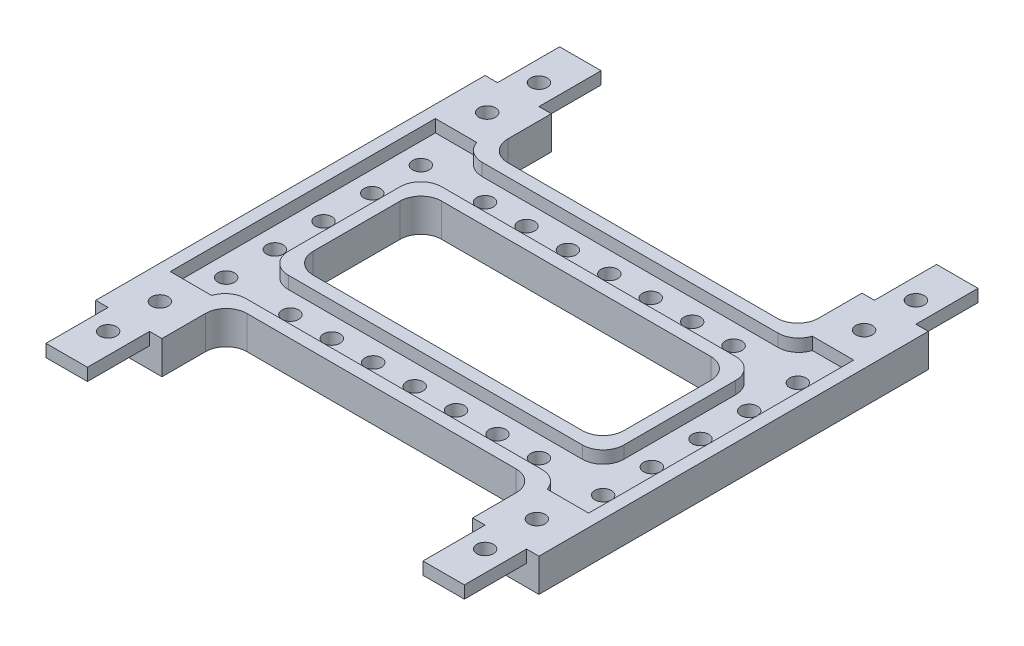
from build123d import *

# Parameters (mm, degrees)
BOSS_EXTRUDE2_DEPTH = 5
SKETCH3_W           = 3
SKETCH3_H           = 94
SKETCH3_W_2         = 75
SKETCH3_H_2         = 31
BOSS_EXTRUDE4_DEPTH = 3
BOSS_EXTRUDE5_DEPTH = 3
SKETCH5_R           = 2
CUT_EXTRUDE1_DEPTH  = 5
SKETCH6_R           = 2
CUT_EXTRUDE2_DEPTH  = 3
SKETCH7_R           = 2
CUT_EXTRUDE3_DEPTH  = 8
FILLET1_R           = 5
FILLET2_R           = 5


with BuildPart() as part:
    # Sketch1 → Boss-Extrude2 (new body)
    with BuildSketch(Plane(origin=(0, 0, 0), x_dir=(1, 0, 0), z_dir=(0, 1, 0))):
        Polygon((-51.065846009, -44.178571429), (-59.065846009, -44.178571429), (-59.065846009, 49.821428571), (-51.065846009, 49.821428571), (-43.065846009, 49.821428571), (-43.065846009, 39.321428571), (-43.065846009, 34.321428571), (-38.065846009, 34.321428571), (26.934153991, 34.321428571), (31.934153991, 34.321428571), (31.934153991, 39.321428571), (31.934153991, 49.821428571), (39.934153991, 49.821428571), (47.934153991, 49.821428571), (47.934153991, -44.178571429), (39.934153991, -44.178571429), (31.934153991, -44.178571429), (31.934153991, -33.678571429), (31.934153991, -28.678571429), (26.934153991, -28.678571429), (-38.065846009, -28.678571429), (-43.065846009, -28.678571429), (-43.065846009, -33.678571429), (-43.065846009, -44.178571429), align=None)
        Polygon((-43.065846009, 13.321428571), (-43.065846009, -7.678571429), (-43.065846009, -12.678571429), (-38.065846009, -12.678571429), (26.934153991, -12.678571429), (31.934153991, -12.678571429), (31.934153991, -7.678571429), (31.934153991, 13.321428571), (31.934153991, 18.321428571), (26.934153991, 18.321428571), (-38.065846009, 18.321428571), (-43.065846009, 18.321428571), align=None, mode=Mode.SUBTRACT)
    extrude(amount=BOSS_EXTRUDE2_DEPTH)

    # Sketch3 → Boss-Extrude4 (add)
    # profile 1 of 5: a face of its own
    with BuildSketch(Plane(origin=(0, 5, 0), x_dir=(1, 0, 0), z_dir=(0, 1, 0))):
        with Locations((-57.565846009, 2.821428571)):
            Rectangle(SKETCH3_W, SKETCH3_H)
    # profile 2 of 5: a face of its own
    with BuildSketch(Plane(origin=(0, 5, 0), x_dir=(1, 0, 0), z_dir=(0, 1, 0))):
        with Locations((46.434153991, 2.821428571)):
            Rectangle(SKETCH3_W, SKETCH3_H)
    # profile 3 of 5: a face of its own
    with BuildSketch(Plane(origin=(0, 5, 0), x_dir=(1, 0, 0), z_dir=(0, 1, 0))):
        Polygon((-43.065846009, 49.821428571), (-46.065846009, 49.821428571), (-46.065846009, 34.321428571), (-46.065846009, 31.321428571), (31.934153991, 31.321428571), (34.934153991, 31.321428571), (34.934153991, 49.821428571), (31.934153991, 49.821428571), (31.934153991, 34.321428571), (-43.065846009, 34.321428571), align=None)
    # profile 4 of 5: a face of its own
    with BuildSketch(Plane(origin=(0, 5, 0), x_dir=(1, 0, 0), z_dir=(0, 1, 0))):
        Polygon((34.934153991, 21.321428571), (34.934153991, -12.678571429), (34.934153991, -15.678571429), (-46.065846009, -15.678571429), (-46.065846009, 21.321428571), (31.934153991, 21.321428571), align=None)
        with Locations((-5.565846009, 2.821428571)):
            Rectangle(SKETCH3_W_2, SKETCH3_H_2, mode=Mode.SUBTRACT)
    # profile 5 of 5: a face of its own
    with BuildSketch(Plane(origin=(0, 5, 0), x_dir=(1, 0, 0), z_dir=(0, 1, 0))):
        Polygon((-46.065846009, -44.178571429), (-43.065846009, -44.178571429), (-43.065846009, -28.678571429), (31.934153991, -28.678571429), (31.934153991, -44.178571429), (34.934153991, -44.178571429), (34.934153991, -28.678571429), (34.934153991, -25.678571429), (-46.065846009, -25.678571429), align=None)
    extrude(amount=BOSS_EXTRUDE4_DEPTH)

    # Sketch4 → Boss-Extrude5 (add)
    with BuildSketch(Plane(origin=(0, 5, 0), x_dir=(1, 0, 0), z_dir=(0, 1, 0))):
        Polygon((-46.065846009, -59.178571429), (-46.065846009, -29.178571429), (-56.065846009, -29.178571429), (-56.065846009, -59.178571429), (-51.065846009, -59.178571429), align=None)
        Polygon((39.934153991, -59.178571429), (44.934153991, -59.178571429), (44.934153991, -29.178571429), (34.934153991, -29.178571429), (34.934153991, -59.178571429), align=None)
        Polygon((-46.065846009, 34.821428571), (-46.065846009, 64.821428571), (-56.065846009, 64.821428571), (-56.065846009, 34.821428571), (-51.065846009, 34.821428571), align=None)
        Polygon((44.934153991, 34.821428571), (44.934153991, 64.821428571), (34.934153991, 64.821428571), (34.934153991, 34.821428571), (39.934153991, 34.821428571), align=None)
    extrude(amount=BOSS_EXTRUDE5_DEPTH)

    # Sketch5 → Cut-Extrude1 (cut)
    with BuildSketch(Plane(origin=(0, 5, 0), x_dir=(1, 0, 0), z_dir=(0, 1, 0))):
        with Locations(Location((-51.065846009, 26.321428571, 0), (0, 0, 270))):
            Circle(SKETCH5_R)
        with Locations(Location((39.934153991, 26.321428571, 0), (0, 0, 270))):
            Circle(SKETCH5_R)
        with Locations(Location((39.934153991, -20.678571429, 0), (0, 0, 270))):
            Circle(SKETCH5_R)
        with Locations(Location((-51.065846009, -20.678571429, 0), (0, 0, 270))):
            Circle(SKETCH5_R)
        with Locations(Location((-51.065846009, 2.821428571, 0), (0, 0, 270))):
            Circle(SKETCH5_R)
        with Locations(Location((39.934153991, 2.821428571, 0), (0, 0, 270))):
            Circle(SKETCH5_R)
        with Locations(Location((-51.065846009, 14.571428571, 0), (0, 0, 270))):
            Circle(SKETCH5_R)
        with Locations(Location((-51.065846009, -8.928571429, 0), (0, 0, 270))):
            Circle(SKETCH5_R)
        with Locations(Location((-5.565846009, 26.321428571, 0), (0, 0, 270))):
            Circle(SKETCH5_R)
        with Locations(Location((14.434153991, 26.321428571, 0), (0, 0, 270))):
            Circle(SKETCH5_R)
        with Locations(Location((24.434153991, 26.321428571, 0), (0, 0, 270))):
            Circle(SKETCH5_R)
        with Locations(Location((-25.565846009, 26.321428571, 0), (0, 0, 270))):
            Circle(SKETCH5_R)
        with Locations(Location((4.434153991, 26.321428571, 0), (0, 0, 270))):
            Circle(SKETCH5_R)
        with Locations(Location((-35.565846009, 26.321428571, 0), (0, 0, 270))):
            Circle(SKETCH5_R)
        with Locations(Location((-15.565846009, 26.321428571, 0), (0, 0, 270))):
            Circle(SKETCH5_R)
        with Locations(Location((-5.565846009, -20.678571429, 0), (0, 0, 270))):
            Circle(SKETCH5_R)
        with Locations(Location((14.434153991, -20.678571429, 0), (0, 0, 270))):
            Circle(SKETCH5_R)
        with Locations(Location((24.434153991, -20.678571429, 0), (0, 0, 270))):
            Circle(SKETCH5_R)
        with Locations(Location((-25.565846009, -20.678571429, 0), (0, 0, 270))):
            Circle(SKETCH5_R)
        with Locations(Location((4.434153991, -20.678571429, 0), (0, 0, 270))):
            Circle(SKETCH5_R)
        with Locations(Location((-35.565846009, -20.678571429, 0), (0, 0, 270))):
            Circle(SKETCH5_R)
        with Locations(Location((-15.565846009, -20.678571429, 0), (0, 0, 270))):
            Circle(SKETCH5_R)
        with Locations(Location((39.934153991, 14.571428571, 0), (0, 0, 270))):
            Circle(SKETCH5_R)
        with Locations(Location((39.934153991, -8.928571429, 0), (0, 0, 270))):
            Circle(SKETCH5_R)
    extrude(amount=-CUT_EXTRUDE1_DEPTH, mode=Mode.SUBTRACT)

    # Sketch6 → Cut-Extrude2 (cut)
    with BuildSketch(Plane.XZ.offset(-5)):
        with Locations(Location((39.934153991, -54.821428571, 0), (0, 0, 270))):
            Circle(SKETCH6_R)
        with Locations(Location((-51.065846009, -54.821428571, 0), (0, 0, 270))):
            Circle(SKETCH6_R)
        with Locations(Location((-51.065846009, 49.178571429, 0), (0, 0, 270))):
            Circle(SKETCH6_R)
        with Locations(Location((39.934153991, 49.178571429, 0), (0, 0, 270))):
            Circle(SKETCH6_R)
    extrude(amount=-CUT_EXTRUDE2_DEPTH, mode=Mode.SUBTRACT)

    # Sketch7 → Cut-Extrude3 (cut)
    with BuildSketch(Plane(origin=(0, 8, 0), x_dir=(1, 0, 0), z_dir=(0, 1, 0))):
        with Locations(Location((-51.065846009, 42.321428571, 0), (0, 0, 270))):
            Circle(SKETCH7_R)
        with Locations(Location((39.934153991, 42.321428571, 0), (0, 0, 270))):
            Circle(SKETCH7_R)
        with Locations(Location((-51.065846009, -36.678571429, 0), (0, 0, 270))):
            Circle(SKETCH7_R)
        with Locations(Location((39.934153991, -36.678571429, 0), (0, 0, 270))):
            Circle(SKETCH7_R)
    extrude(amount=-CUT_EXTRUDE3_DEPTH, mode=Mode.SUBTRACT)

    # Fillet1
    fillet1_edges = [part.edges().sort_by_distance(p)[0] for p in [
        (31.934153991, 4, 28.678571429),
        (-43.065846009, 4, 28.678571429),
        (-43.065846009, 4, -34.321428571),
        (31.934153991, 4, -34.321428571),
        (-43.065846009, 4, -18.321428571),
        (-43.065846009, 4, 12.678571429),
        (31.934153991, 4, 12.678571429),
        (31.934153991, 4, -18.321428571),
    ]]
    fillet(fillet1_edges, radius=FILLET1_R)

    # Fillet2
    # the kernel refuses this fillet: 5 mm, written as the material it takes off along each edge
    with BuildSketch(Plane(origin=(-46.065846009, 5, -31.321428571), x_dir=(1, 0, 0), z_dir=(0, 1, 0))) as fillet2_piece_1:
        with BuildLine():
            CenterArc((4.769696007, 5), FILLET2_R, 197.457603124, 72.542396876)
            Line((0, 3.5), (0, 0))
            Line((0, 0), (4.769696007, 0))
        make_face()
    extrude(amount=14.924240018, mode=Mode.SUBTRACT)
    with BuildSketch(Plane(origin=(34.934153991, 5, -31.321428571), x_dir=(0, 0, -1), z_dir=(0, 1, 0))) as fillet2_piece_2:
        with BuildLine():
            CenterArc((5, 4.769696007), FILLET2_R, 180, 72.542396876)
            Line((0, 4.769696007), (0, 0))
            Line((0, 0), (3.5, 0))
        make_face()
    extrude(amount=14.924240018, mode=Mode.SUBTRACT)
    with BuildSketch(Plane(origin=(-46.065846009, 5, 25.678571429), x_dir=(1, 0, 0), z_dir=(0, 1, 0))) as fillet2_piece_3:
        with BuildLine():
            CenterArc((4.769696007, -5), FILLET2_R, 90, 72.542396876)
            Line((0, -3.5), (0, 0))
            Line((0, 0), (4.769696007, 0))
        make_face()
    extrude(amount=14.924240018, mode=Mode.SUBTRACT)
    with BuildSketch(Plane(origin=(34.934153991, 5, 25.678571429), x_dir=(0, 0, 1), z_dir=(0, 1, 0))) as fillet2_piece_4:
        with BuildLine():
            CenterArc((5, -4.769696007), FILLET2_R, 107.457603124, 72.542396876)
            Line((0, -4.769696007), (0, 0))
            Line((0, 0), (3.5, 0))
        make_face()
    extrude(amount=14.924240018, mode=Mode.SUBTRACT)
    with BuildSketch(Plane(origin=(-46.065846009, 5, -21.321428571), x_dir=(0, 0, 1), z_dir=(0, 1, 0)), Plane(origin=(-46.065846009, 5, 15.678571429), x_dir=(1, 0, 0), z_dir=(0, 1, 0))) as fillet2_piece_5:
        with BuildLine():
            CenterArc((FILLET2_R, FILLET2_R), FILLET2_R, 180, 90)
            Line((0, FILLET2_R), (0, 0))
            Line((0, 0), (FILLET2_R, 0))
        make_face()
    extrude(amount=15.5, mode=Mode.SUBTRACT)
    with BuildSketch(Plane(origin=(34.934153991, 5, 15.678571429), x_dir=(-1, 0, 0), z_dir=(0, 1, 0)), Plane(origin=(34.934153991, 5, -21.321428571), x_dir=(0, 0, 1), z_dir=(0, 1, 0))) as fillet2_piece_6:
        with BuildLine():
            CenterArc((FILLET2_R, -FILLET2_R), FILLET2_R, 90, 90)
            Line((0, -FILLET2_R), (0, 0))
            Line((0, 0), (FILLET2_R, 0))
        make_face()
    extrude(amount=15.5, mode=Mode.SUBTRACT)


solid = part.part
